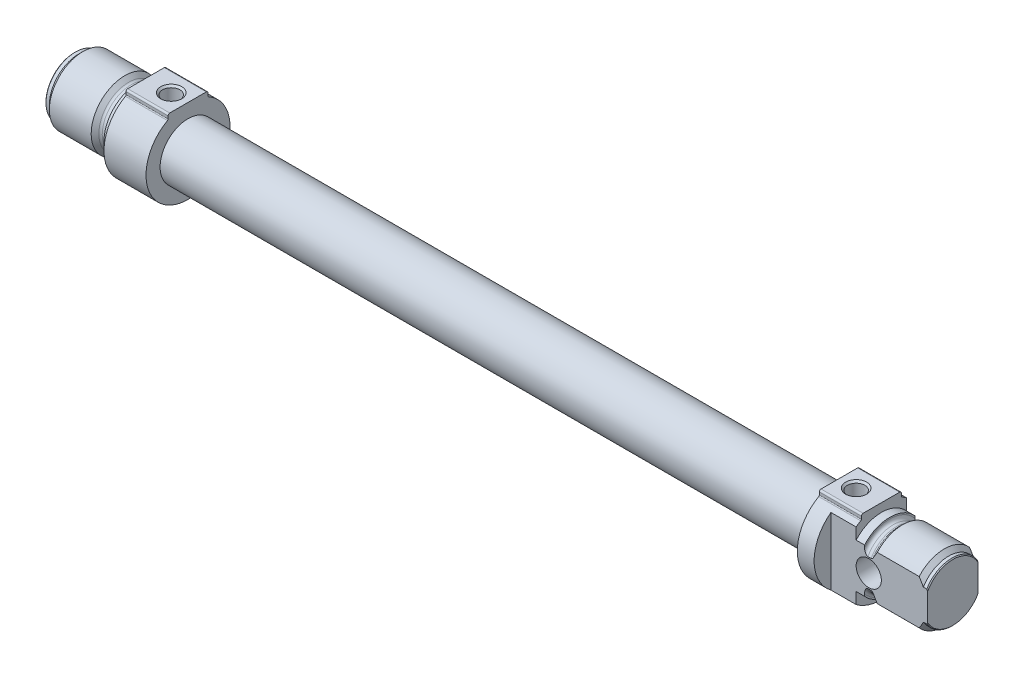
from build123d import *

# Parameters (mm, degrees)
AUFSATZ_LINEAR_AUSTRAGEN1_DEPTH      = 10
SKIZZE3_W                            = 155
SKIZZE3_H                            = 6.65
AUFSATZ_LINEAR_AUSTRAGEN2_DEPTH      = 10
SCHNITT_LINEAR_AUSTRAGEN1_DEPTH      = 10
SCHNITT_LINEAR_AUSTRAGEN1_DEPTH_BACK = 10
BOHRUNG1_D                           = 6
BOHRUNG2_D                           = 4.134
BOHRUNG2_DEPTH                       = 10
BOHRUNG2_CSINK_D                     = 5
BOHRUNG2_CSINK_ANGLE                 = 90
BOHRUNG3_D                           = 4.134
BOHRUNG3_DEPTH                       = 11
BOHRUNG3_CSINK_D                     = 5
BOHRUNG3_CSINK_ANGLE                 = 90
BOHRUNG3_TIP                         = 1.193383006


with BuildPart() as part:
    # Skizze1 → Rotation1 (revolve)
    with BuildSketch(Plane.XY):
        with BuildLine():
            Line((0, 0), (0, 6.8))
            Line((0, 6.8), (0.2, 7))
            Line((0.2, 7), (1, 7))
            Line((1, 7), (2, 8))
            Line((2, 8), (11.95, 8))
            Line((11.95, 8), (12.865685425, 7.084314575))
            ThreePointArc((12.865685425, 7.084314575), (13.125224104, 6.910896374), (13.43137085, 6.85))
            Line((13.43137085, 6.85), (14.2, 6.85))
            ThreePointArc((14.2, 6.85), (14.765685425, 7.084314575), (15, 7.65))
            Line((15, 7.65), (15, 8))
            Line((15, 8), (17, 8))
            Line((17, 8), (17, 0))
            Line((17, 0), (0, 0))
        make_face()
    revolve(axis=Axis((17, 0, 0), (-1, 0, 0)))

    # Skizze2 → Aufsatz-Linear austragen1 (add)
    with BuildSketch(Plane(origin=(17, 0, 0), x_dir=(0, 0, -1), z_dir=(1, 0, 0))):
        with BuildLine():
            Line((4.75, 8.977054082), (4.75, 9.6))
            ThreePointArc((4.75, 9.6), (4.632842712, 9.882842712), (4.35, 10))
            Line((4.35, 10), (-4.35, 10))
            ThreePointArc((-4.35, 10), (-4.632842712, 9.882842712), (-4.75, 9.6))
            Line((-4.75, 9.6), (-4.75, 8.977054082))
            ThreePointArc((-4.75, 8.977054082), (-4.791034545, 8.825604773), (-4.902912621, 8.715586488))
            ThreePointArc((-4.902912621, 8.715586488), (0, -10), (4.902912621, 8.715586488))
            ThreePointArc((4.902912621, 8.715586488), (4.791034545, 8.825604773), (4.75, 8.977054082))
        make_face()
    extrude(amount=AUFSATZ_LINEAR_AUSTRAGEN1_DEPTH)

    # Skizze3 → Rotation2 (revolve)
    with BuildSketch(Plane.XY):
        with Locations((104.5, 3.325)):
            Rectangle(SKIZZE3_W, SKIZZE3_H)
    revolve(axis=Axis((182, 0, 0), (-1, 0, 0)))

    # Skizze4 → Aufsatz-Linear austragen2 (add)
    with BuildSketch(Plane(origin=(182, 0, 0), x_dir=(0, 0, -1), z_dir=(1, 0, 0))):
        with BuildLine():
            Line((4.75, 8.977054082), (4.75, 9.6))
            ThreePointArc((4.75, 9.6), (4.632842712, 9.882842712), (4.35, 10))
            Line((4.35, 10), (-4.35, 10))
            ThreePointArc((-4.35, 10), (-4.632842712, 9.882842712), (-4.75, 9.6))
            Line((-4.75, 9.6), (-4.75, 8.977054082))
            ThreePointArc((-4.75, 8.977054082), (-4.791034545, 8.825604773), (-4.902912621, 8.715586488))
            ThreePointArc((-4.902912621, 8.715586488), (0, -10), (4.902912621, 8.715586488))
            ThreePointArc((4.902912621, 8.715586488), (4.791034545, 8.825604773), (4.75, 8.977054082))
        make_face()
    extrude(amount=AUFSATZ_LINEAR_AUSTRAGEN2_DEPTH)

    # Skizze5 → Rotation3 (revolve)
    with BuildSketch(Plane.XY):
        with BuildLine():
            Line((192, 0), (192, 8))
            Line((192, 8), (194, 8))
            Line((194, 8), (194, 7.65))
            ThreePointArc((194, 7.65), (194.234314575, 7.084314575), (194.8, 6.85))
            Line((194.8, 6.85), (195.56862915, 6.85))
            ThreePointArc((195.56862915, 6.85), (195.874775896, 6.910896374), (196.134314575, 7.084314575))
            Line((196.134314575, 7.084314575), (197.05, 8))
            Line((197.05, 8), (207, 8))
            Line((207, 8), (208, 7))
            Line((208, 7), (208.8, 7))
            Line((208.8, 7), (209, 6.8))
            Line((209, 6.8), (209, 0))
            Line((209, 0), (192, 0))
        make_face()
    revolve(axis=Axis((209, 0, 0), (-1, 0, 0)))

    # Skizze6 → Schnitt-Linear austragen1 (cut, two sides: drawn at the far end of the back side and taken through both)
    with BuildSketch(Plane(origin=(0, 0, 0), x_dir=(1, 0, 0), z_dir=(0, 1, 0)).offset(-SCHNITT_LINEAR_AUSTRAGEN1_DEPTH_BACK)):
        Polygon((186, 18), (186, 6), (209, 6), (209, -6), (186, -6), (186, -18), (221, -18), (221, 18), align=None)
    extrude(amount=SCHNITT_LINEAR_AUSTRAGEN1_DEPTH + SCHNITT_LINEAR_AUSTRAGEN1_DEPTH_BACK, mode=Mode.SUBTRACT)

    # Bohrung1 (through all)
    with Locations(Plane(origin=(0, 0, -6), x_dir=(-1, 0, 0), z_dir=(0, 0, -1))):
        with Locations((-195, 0)):
            Hole(BOHRUNG1_D / 2)

    # Bohrung2
    with Locations(Plane(origin=(0, 10, 0), x_dir=(1, 0, 0), z_dir=(0, 1, 0))):
        with Locations((23, 0)):
            CounterSinkHole(BOHRUNG2_D / 2, BOHRUNG2_CSINK_D / 2, depth=BOHRUNG2_DEPTH, counter_sink_angle=BOHRUNG2_CSINK_ANGLE)

    # Bohrung3
    with Locations(Plane(origin=(0, 10, 0), x_dir=(1, 0, 0), z_dir=(0, 1, 0))):
        with Locations((186, 0)):
            CounterSinkHole(BOHRUNG3_D / 2, BOHRUNG3_CSINK_D / 2, depth=BOHRUNG3_DEPTH, counter_sink_angle=BOHRUNG3_CSINK_ANGLE)
            with Locations((0, 0, -(BOHRUNG3_DEPTH + BOHRUNG3_TIP / 2))):  # 120° drill point
                Cone(0, BOHRUNG3_D / 2, BOHRUNG3_TIP, mode=Mode.SUBTRACT)

    # Skizze13 → Schnitt-Rotation1 (revolve, cut)
    with BuildSketch(Plane.XY):
        Polygon((-5, 0), (-5, 3), (37.3, 3), (37.3, 6), (165.3, 6), (165.3, 0), align=None)
    revolve(axis=Axis((165.3, 0, 0), (-1, 0, 0)), mode=Mode.SUBTRACT)


solid = part.part
